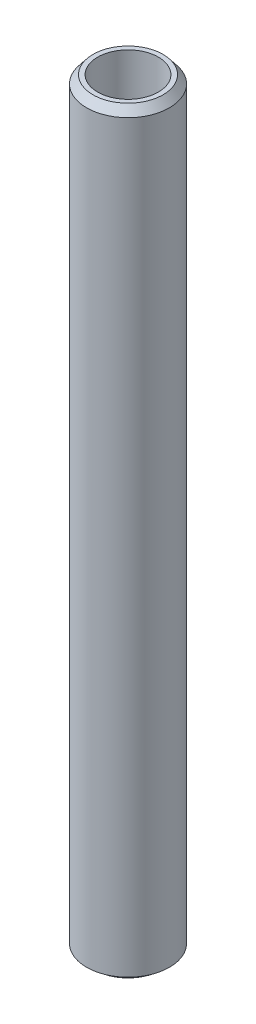
from build123d import *
from OCP.BRepFilletAPI import BRepFilletAPI_MakeChamfer

# Parameters (mm, degrees)
SKETCH1_R           = 20
BOSS_EXTRUDE1_DEPTH = 366.321487048
SKETCH2_R           = 14.653156495
CUT_EXTRUDE1_DEPTH  = 368.411801488
CHAMFER1_SIZE       = 3.89120744
CHAMFER1_SIZE2      = 3.081045729


with BuildPart() as part:
    # Sketch1 → Boss-Extrude1 (new body)
    with BuildSketch(Plane(origin=(0, 0, 0), x_dir=(1, 0, 0), z_dir=(0, 1, 0))):
        Circle(SKETCH1_R)
    extrude(amount=BOSS_EXTRUDE1_DEPTH)

    # Sketch2 → Cut-Extrude1 (cut, through all)
    with BuildSketch(Plane(origin=(0, 0, 0), x_dir=(1, 0, 0), z_dir=(0, 1, 0))):
        Circle(SKETCH2_R)
    extrude(amount=CUT_EXTRUDE1_DEPTH, mode=Mode.SUBTRACT)

    # Chamfer1: one chamfer whose edges measure the first distance from different faces: ONE call of the kernel's chamfer builder (chamfer() names one face for all edges)
    chamfer1_edges_1 = [part.edges().sort_by_distance(p)[0] for p in [
        (-20, 366.321487048, 0),
    ]]
    chamfer1_side_1 = [part.faces().sort_by_distance(p)[0] for p in [
        (-20, 183.160743524, 0),
    ]]
    chamfer1_edges_2 = [part.edges().sort_by_distance(p)[0] for p in [
        (-20, 0, 0),
    ]]
    chamfer1_side_2 = [part.faces().sort_by_distance(p)[0] for p in [
        (-19.434314575, 0, 0),
    ]]
    chamfer1 = BRepFilletAPI_MakeChamfer(part.part.solid().wrapped)
    for e in chamfer1_edges_1:
        chamfer1.Add(CHAMFER1_SIZE, CHAMFER1_SIZE2, e.wrapped, chamfer1_side_1[0].wrapped)  # the first distance lies on this face
    for e in chamfer1_edges_2:
        chamfer1.Add(CHAMFER1_SIZE, CHAMFER1_SIZE2, e.wrapped, chamfer1_side_2[0].wrapped)  # the first distance lies on this face
    add(Compound.cast(chamfer1.Shape()), mode=Mode.REPLACE)


solid = part.part
